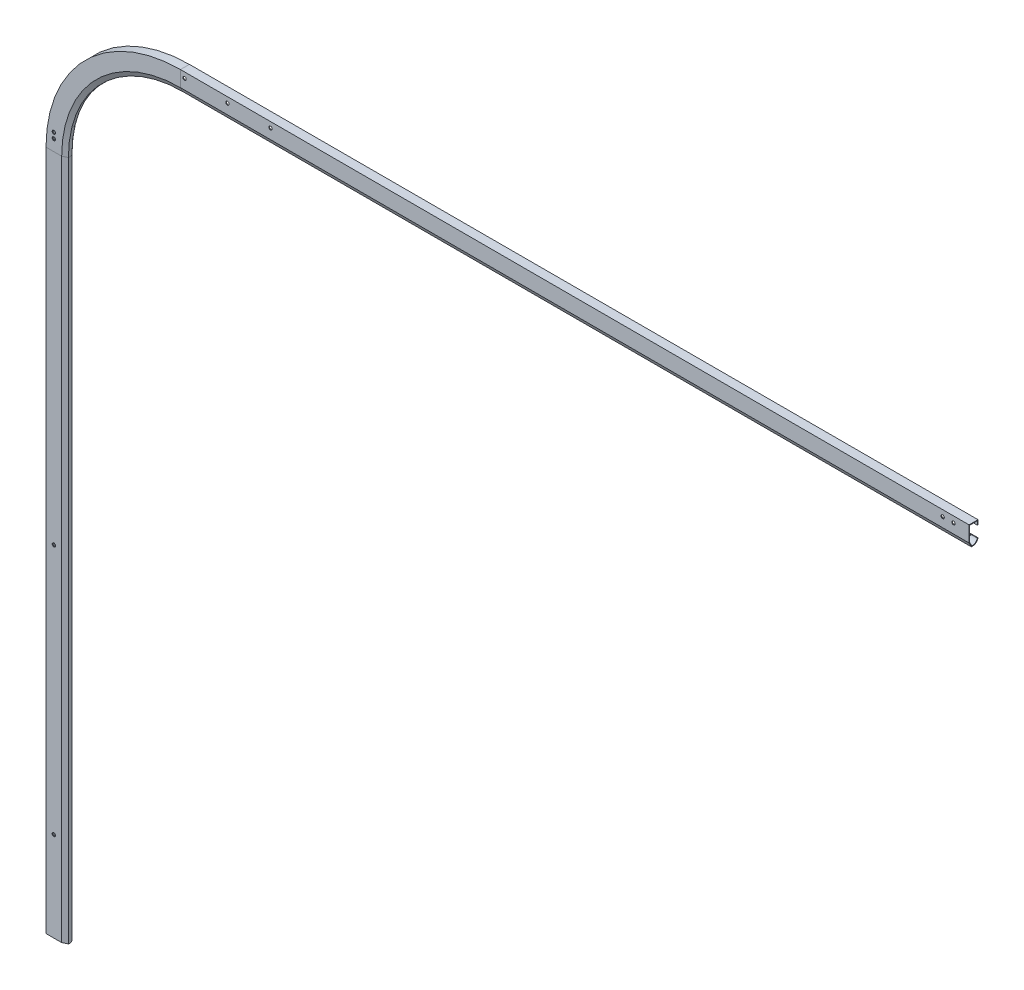
from build123d import *

# Parameters (mm, degrees)
BOSS_EXTRUDE1_DEPTH = 2.54
SWEEP1_START        = 2.54
SWEEP1_DEPTH        = 1927.86
SWEEP1_START_2      = 381.019111525
SWEEP1_2_DEPTH      = 2235.2
SWEEP1_3_ANGLE      = 90
CUT_EXTRUDE1_REACH  = 3493.118
SKETCH4_R           = 4.7625
CUT_EXTRUDE2_REACH  = 3493.118
SKETCH5_R           = 4.7625
BOSS_EXTRUDE2_DEPTH = 2.54
FILLET1_R           = 2.54
SKETCH7_R           = 4.7625
CUT_EXTRUDE3_DEPTH  = 3492.1181459


with BuildPart() as part:
    # Sketch2 → Boss-Extrude1 (new body)
    with BuildSketch(Plane(origin=(0, 0, 0), x_dir=(1, 0, 0), z_dir=(0, 1, 0))):
        with BuildLine():
            Line((0, 25.4), (12.7, 25.4))
            ThreePointArc((12.7, 25.4), (13.094538418, 24.4475), (12.7, 23.495))
            Line((12.7, 23.495), (1.905, 23.495))
            Line((1.905, 23.495), (1.905, 1.905))
            Line((1.905, 1.905), (34.925, 1.905))
            Line((34.925, 1.905), (44.000290503, 1.905))
            Line((44.000290503, 1.905), (55.431897483, 7.62080349))
            ThreePointArc((55.431897483, 7.62080349), (52.902013686, 17.822967428), (44.076398763, 23.531993813))
            ThreePointArc((44.076398763, 23.531993813), (43.876322633, 24.543372256), (44.45, 25.4))
            ThreePointArc((44.45, 25.4), (54.745384182, 18.505256121), (57.15, 6.35))
            Line((57.15, 6.35), (44.45, 0))
            Line((44.45, 0), (34.925, 0))
            Line((34.925, 0), (0, 0))
            Line((0, 0), (0, 25.4))
        make_face()
    extrude(amount=BOSS_EXTRUDE1_DEPTH)

    # Sweep1: read off the stored shape, not the designer's step
    # Sweep1 outline → Sweep1 (add)
    with BuildSketch(Plane(origin=(0, 0, 0), x_dir=(1, 0, 0), z_dir=(0, 1, 0)).offset(SWEEP1_START)):
        with BuildLine():
            Line((0, 0), (44.45, 0))
            Line((44.45, 0), (57.15, 6.35))
            ThreePointArc((57.15, 6.35), (54.745384182, 18.505256121), (44.45, 25.4))
            ThreePointArc((44.45, 25.4), (43.876322633, 24.543372256), (44.076398763, 23.531993813))
            ThreePointArc((44.076398763, 23.531993813), (52.902013686, 17.822967428), (55.431897483, 7.62080349))
            Line((55.431897483, 7.62080349), (44.000290503, 1.905))
            Line((44.000290503, 1.905), (1.905, 1.905))
            Line((1.905, 1.905), (1.905, 23.495))
            Line((1.905, 23.495), (12.7, 23.495))
            ThreePointArc((12.7, 23.495), (13.094538418, 24.4475), (12.7, 25.4))
            Line((12.7, 25.4), (0, 25.4))
            Line((0, 25.4), (0, 0))
        make_face()
    extrude(amount=SWEEP1_DEPTH)



with BuildPart() as body_2:
    # Sweep1 2 outline → Sweep1 2 (new body)
    with BuildSketch(Plane.YZ.offset(SWEEP1_START_2)):
        with BuildLine():
            Line((2311.419111525, -25.4), (2311.419111525, 0))
            Line((2311.419111525, 0), (2266.969111525, 0))
            Line((2266.969111525, 0), (2254.269111525, -6.35))
            ThreePointArc((2254.269111525, -6.35), (2256.673727343, -18.505256121), (2266.969111525, -25.4))
            ThreePointArc((2266.969111525, -25.4), (2267.542788892, -24.543372256), (2267.342712762, -23.531993813))
            ThreePointArc((2267.342712762, -23.531993813), (2258.517097838, -17.822967428), (2255.987214041, -7.62080349))
            Line((2255.987214041, -7.62080349), (2267.418821022, -1.905))
            Line((2267.418821022, -1.905), (2309.514111525, -1.905))
            Line((2309.514111525, -1.905), (2309.514111525, -23.495))
            Line((2309.514111525, -23.495), (2298.719111525, -23.495))
            ThreePointArc((2298.719111525, -23.495), (2298.324573106, -24.4475), (2298.719111525, -25.4))
            Line((2298.719111525, -25.4), (2311.419111525, -25.4))
        make_face()
    extrude(amount=SWEEP1_2_DEPTH)


with BuildPart() as part_1:
    add(part.part)

    add(body_2.part)  # Sweep1 3 merges body 2
    # Sweep1 3 outline → Sweep1 3 (revolve)
    with BuildSketch(Plane(origin=(381.019111525, 1930.4, 0), x_dir=(0, 1, 0), z_dir=(1, 0, 0))):
        with BuildLine():
            Line((336.569111525, 0), (323.869111525, -6.35))
            ThreePointArc((323.869111525, -6.35), (326.273727343, -18.505256121), (336.569111525, -25.4))
            ThreePointArc((336.569111525, -25.4), (337.142788892, -24.543372256), (336.942712762, -23.531993813))
            ThreePointArc((336.942712762, -23.531993813), (328.117097838, -17.822967428), (325.587214041, -7.62080349))
            Line((325.587214041, -7.62080349), (337.018821022, -1.905))
            Line((337.018821022, -1.905), (379.114111525, -1.905))
            Line((379.114111525, -1.905), (379.114111525, -23.495))
            Line((379.114111525, -23.495), (368.319111525, -23.495))
            ThreePointArc((368.319111525, -23.495), (367.924573106, -24.4475), (368.319111525, -25.4))
            Line((368.319111525, -25.4), (381.019111525, -25.4))
            Line((381.019111525, -25.4), (381.019111525, 0))
            Line((381.019111525, 0), (336.569111525, 0))
        make_face()
    revolve(axis=Axis((381.019111525, 1930.4, 0), (0, 0, 1)), revolution_arc=SWEEP1_3_ANGLE)

    # Sketch4 → Cut-Extrude1 (cut, up to next)
    with BuildSketch(Plane.XY, mode=Mode.PRIVATE) as cut_extrude1_sk1:
        with Locations((22.225, 254)):
            Circle(SKETCH4_R)
    cut_extrude1_tool1 = extrude(cut_extrude1_sk1.sketch, amount=-CUT_EXTRUDE1_REACH, mode=Mode.PRIVATE) & part_1.part
    # Sketch4 → Cut-Extrude1 (cut, up to next)
    with BuildSketch(Plane.XY, mode=Mode.PRIVATE) as cut_extrude1_sk2:
        with Locations((22.225, 965.2)):
            Circle(SKETCH4_R)
    cut_extrude1_tool2 = extrude(cut_extrude1_sk2.sketch, amount=-CUT_EXTRUDE1_REACH, mode=Mode.PRIVATE) & part_1.part
    # Sketch4 → Cut-Extrude1 (cut, up to next)
    with BuildSketch(Plane.XY, mode=Mode.PRIVATE) as cut_extrude1_sk3:
        with Locations((22.225, 1977.917111525)):
            Circle(SKETCH4_R)
    cut_extrude1_tool3 = extrude(cut_extrude1_sk3.sketch, amount=-CUT_EXTRUDE1_REACH, mode=Mode.PRIVATE) & part_1.part
    # Sketch4 → Cut-Extrude1 (cut, up to next)
    with BuildSketch(Plane.XY, mode=Mode.PRIVATE) as cut_extrude1_sk4:
        with Locations((22.225, 1961.915111525)):
            Circle(SKETCH4_R)
    cut_extrude1_tool4 = extrude(cut_extrude1_sk4.sketch, amount=-CUT_EXTRUDE1_REACH, mode=Mode.PRIVATE) & part_1.part
    add(cut_extrude1_tool1.solids().sort_by_distance((22.225, 254, 0))[0], mode=Mode.SUBTRACT)
    add(cut_extrude1_tool2.solids().sort_by_distance((22.225, 965.2, 0))[0], mode=Mode.SUBTRACT)
    add(cut_extrude1_tool3.solids().sort_by_distance((22.225, 1977.917112, 0))[0], mode=Mode.SUBTRACT)
    add(cut_extrude1_tool4.solids().sort_by_distance((22.225, 1961.915112, 0))[0], mode=Mode.SUBTRACT)

    # Sketch5 → Cut-Extrude2 (cut, up to next)
    with BuildSketch(Plane.XY, mode=Mode.PRIVATE) as cut_extrude2_sk1:
        with Locations((392.773679289, 2295.48078944)):
            Circle(SKETCH5_R)
    cut_extrude2_tool1 = extrude(cut_extrude2_sk1.sketch, amount=-CUT_EXTRUDE2_REACH, mode=Mode.PRIVATE) & part_1.part
    # Sketch5 → Cut-Extrude2 (cut, up to next)
    with BuildSketch(Plane.XY, mode=Mode.PRIVATE) as cut_extrude2_sk2:
        with Locations((514.387968665, 2295.48078944)):
            Circle(SKETCH5_R)
    cut_extrude2_tool2 = extrude(cut_extrude2_sk2.sketch, amount=-CUT_EXTRUDE2_REACH, mode=Mode.PRIVATE) & part_1.part
    # Sketch5 → Cut-Extrude2 (cut, up to next)
    with BuildSketch(Plane.XY, mode=Mode.PRIVATE) as cut_extrude2_sk3:
        with Locations((636.351596179, 2295.48078944)):
            Circle(SKETCH5_R)
    cut_extrude2_tool3 = extrude(cut_extrude2_sk3.sketch, amount=-CUT_EXTRUDE2_REACH, mode=Mode.PRIVATE) & part_1.part
    add(cut_extrude2_tool1.solids().sort_by_distance((392.773679, 2295.480789, 0))[0], mode=Mode.SUBTRACT)
    add(cut_extrude2_tool2.solids().sort_by_distance((514.387969, 2295.480789, 0))[0], mode=Mode.SUBTRACT)
    add(cut_extrude2_tool3.solids().sort_by_distance((636.351596, 2295.480789, 0))[0], mode=Mode.SUBTRACT)

    # Sketch6 → Boss-Extrude2 (add)
    with BuildSketch(Plane(origin=(0, 0, -1.905), x_dir=(-1, 0, 0), z_dir=(0, 0, -1))):
        with BuildLine():
            Line((-2616.219111525, 2285.926466273), (-2616.219111525, 2283.386466273))
            Line((-2616.219111525, 2283.386466273), (-381.019111525, 2283.386466273))
            ThreePointArc((-381.019111525, 2283.386466273), (-131.419987556, 2179.999123969), (-28.032645251, 1930.4))
            Line((-28.032645251, 1930.4), (-28.032645251, 0))
            Line((-28.032645251, 0), (-25.492645251, 0))
            Line((-25.492645251, 0), (-25.492645251, 1930.4))
            ThreePointArc((-25.492645251, 1930.4), (-129.623936332, 2181.795175193), (-381.019111525, 2285.926466273))
            Line((-381.019111525, 2285.926466273), (-2616.219111525, 2285.926466273))
        make_face()
    extrude(amount=BOSS_EXTRUDE2_DEPTH)

    # Fillet1
    # the kernel refuses this fillet: 2.54 mm, written as the material it takes off along each edge
    with BuildSketch(Plane(origin=(25.492645251, -6.35, -4.445), x_dir=(0, 0, 1), z_dir=(0, 1, 0)), Plane(origin=(28.032645251, 1930.4, -4.445), x_dir=(0, 0, 1), z_dir=(0, -1, 0))) as fillet1_piece_1:
        with BuildLine():
            CenterArc((FILLET1_R, FILLET1_R), FILLET1_R, 180, 90)
            Line((0, FILLET1_R), (0, 0))
            Line((0, 0), (FILLET1_R, 0))
        make_face()
    extrude(amount=1936.75, mode=Mode.SUBTRACT)
    with BuildSketch(Plane(origin=(381.019111525, 1930.4, -4.445), x_dir=(-1, 0, 0), z_dir=(0, -1, 0))) as fillet1_piece_2:
        with BuildLine():
            CenterArc((355.526466273 - FILLET1_R, -FILLET1_R), FILLET1_R, 0, 90)
            Line((355.526466273, -FILLET1_R), (355.526466273, 0))
            Line((355.526466273, 0), (355.526466273 - FILLET1_R, 0))
        make_face()
    revolve(axis=Axis((381.019111525, 1930.4, -4.445), (0, 0, -1)), revolution_arc=90, mode=Mode.SUBTRACT)
    with BuildSketch(Plane(origin=(381.019111525, 1930.4, -4.445), x_dir=(0, 1, 0), z_dir=(1, 0, 0))) as fillet1_piece_3:
        with BuildLine():
            CenterArc((352.986466273 + FILLET1_R, FILLET1_R), FILLET1_R, 180, 90)
            Line((352.986466273 + FILLET1_R, 0), (352.986466273, 0))
            Line((352.986466273, 0), (352.986466273, FILLET1_R))
        make_face()
    revolve(axis=Axis((381.019111525, 1930.4, -4.445), (0, 0, 1)), revolution_arc=90, mode=Mode.SUBTRACT)
    with BuildSketch(Plane(origin=(381.019111525, 2285.926466273, -4.445), x_dir=(0, -1, 0), z_dir=(1, 0, 0))) as fillet1_piece_4:
        with BuildLine():
            CenterArc((FILLET1_R, -FILLET1_R), FILLET1_R, 90, 90)
            Line((0, -FILLET1_R), (0, 0))
            Line((0, 0), (FILLET1_R, 0))
        make_face()
    extrude(amount=2241.55, mode=Mode.SUBTRACT)
    with BuildSketch(Plane(origin=(2622.569111525, 2283.386466273, -4.445), x_dir=(0, 0, 1), z_dir=(-1, 0, 0))) as fillet1_piece_5:
        with BuildLine():
            CenterArc((FILLET1_R, FILLET1_R), FILLET1_R, 180, 90)
            Line((0, FILLET1_R), (0, 0))
            Line((0, 0), (FILLET1_R, 0))
        make_face()
    extrude(amount=2241.55, mode=Mode.SUBTRACT)

    # Sketch7 → Cut-Extrude3 (cut, through all)
    with BuildSketch(Plane.XY):
        with Locations((2572.148894219, 2294.006465832)):
            Circle(SKETCH7_R)
        with Locations((2541.405669578, 2294.006465832)):
            Circle(SKETCH7_R)
    extrude(amount=-CUT_EXTRUDE3_DEPTH, mode=Mode.SUBTRACT)


solid = part_1.part
